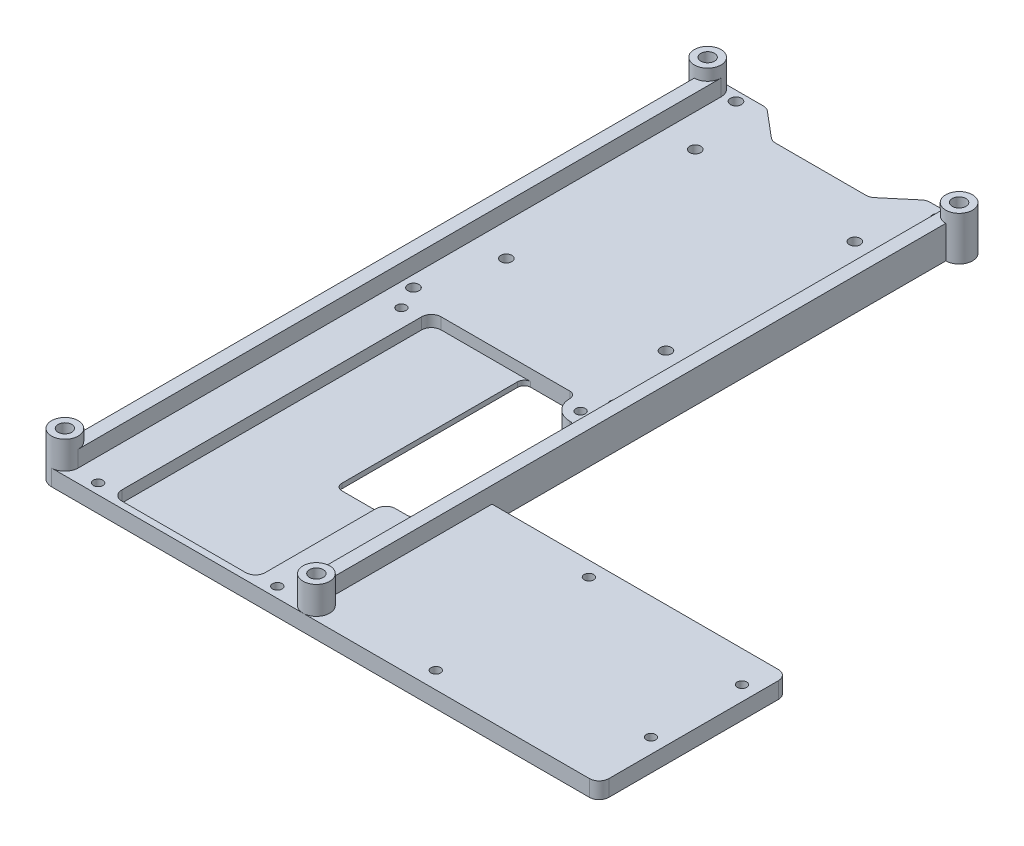
from build123d import *

# Parameters (mm, degrees)
ESQUISSE1_R                                = 1.7
ESQUISSE1_R_2                              = 1.45
BOSS_EXTRU_1_DEPTH                         = 5
ESQUISSE2_W                                = 44
ESQUISSE2_H                                = 98
ENL_V_MAT_PCB_ECRAN_INO_DEPTH              = 3.5
ENL_V_MAT_PCB_EXCROISSANCE_ECRAN_INO_DEPTH = 201.128708585
CONG_EXCROISSANCE_PCB_ECRAN_INO_R          = 2
ESQUISSE10_R                               = 2.1
BOSS_EXTRU_3_DEPTH                         = 13.5
ENL_V_START                                = -8.5
ESQUISSE13_R                               = 5.798275606
ESQUISSE13_R_2                             = 4.1
ENL_V_MAT_EXTRU_4_DEPTH                    = 8.5
ESQUISSE14_R                               = 2.1
ENL_V_MAT_EXTRU_5_DEPTH                    = 201.24672282
CONG_1_R                                   = 6
BOSS_EXTRU_10_DEPTH                        = 10
BOSS_EXTRU_10_2_DEPTH                      = 10
CONG_GLOBAL_R                              = 3


with BuildPart() as part:
    # Esquisse1 → Boss.-Extru.1 (new body)
    with BuildSketch(Plane(origin=(0, 0, 0), x_dir=(1, 0, 0), z_dir=(0, 1, 0))):
        Polygon((-15, 45), (15, 45), (24.5, 53), (34.5, 53), (34.5, -53), (34.5, -94.5), (129.5, -94.5), (129.5, -152.5), (34.5, -152.5), (-34.5, -152.5), (-34.5, -53), (-34.5, 53), (-24.5, 53), align=None)
        with Locations(Location((31, 50, 0), (0, 0, 270))):
            Circle(ESQUISSE1_R, mode=Mode.SUBTRACT)
        with Locations(Location((31, -49, 0), (0, 0, 90))):
            Circle(ESQUISSE1_R, mode=Mode.SUBTRACT)
        with Locations(Location((27.5, -56.2, 0), (0, 0, 270))):
            Circle(ESQUISSE1_R_2, mode=Mode.SUBTRACT)
        with Locations(Location((27.5, -149.3, 0), (0, 0, 90))):
            Circle(ESQUISSE1_R_2, mode=Mode.SUBTRACT)
        with Locations(Location((-27.5, -149.3, 0), (0, 0, 270))):
            Circle(ESQUISSE1_R_2, mode=Mode.SUBTRACT)
        with Locations(Location((-27.5, -56.2, 0), (0, 0, 90))):
            Circle(ESQUISSE1_R_2, mode=Mode.SUBTRACT)
        with Locations(Location((-31, -49, 0), (0, 0, 270))):
            Circle(ESQUISSE1_R, mode=Mode.SUBTRACT)
        with Locations(Location((-31, 50, 0), (0, 0, 90))):
            Circle(ESQUISSE1_R, mode=Mode.SUBTRACT)
        with Locations(Location((-24.5, 31, 0), (0, 0, 270))):
            Circle(ESQUISSE1_R, mode=Mode.SUBTRACT)
        with Locations(Location((24.5, 31, 0), (0, 0, 90))):
            Circle(ESQUISSE1_R, mode=Mode.SUBTRACT)
        with Locations(Location((72.889998169, -99.04, 0), (0, 0, 270))):
            Circle(ESQUISSE1_R_2, mode=Mode.SUBTRACT)
        with Locations(Location((24.5, -27, 0), (0, 0, 270))):
            Circle(ESQUISSE1_R, mode=Mode.SUBTRACT)
        with Locations(Location((-24.5, -27, 0), (0, 0, 90))):
            Circle(ESQUISSE1_R, mode=Mode.SUBTRACT)
        with Locations(Location((124.959998169, -104.12, 0), (0, 0, 270))):
            Circle(ESQUISSE1_R_2, mode=Mode.SUBTRACT)
        with Locations(Location((124.959998169, -132.06, 0), (0, 0, 270))):
            Circle(ESQUISSE1_R_2, mode=Mode.SUBTRACT)
        with Locations(Location((74.159998169, -147.3, 0), (0, 0, 270))):
            Circle(ESQUISSE1_R_2, mode=Mode.SUBTRACT)
    extrude(amount=BOSS_EXTRU_1_DEPTH)

    # Esquisse2 → Enlèv. mat.-pcb ecran ino (cut)
    with BuildSketch(Plane(origin=(0, 5, 0), x_dir=(1, 0, 0), z_dir=(0, 1, 0))):
        with Locations((0, -101.5)):
            Rectangle(ESQUISSE2_W, ESQUISSE2_H)
    extrude(amount=-ENL_V_MAT_PCB_ECRAN_INO_DEPTH, mode=Mode.SUBTRACT)

    # Esquisse3 → Enlèv. mat.- pcb excroissance ecran ino (cut, through all)
    with BuildSketch(Plane(origin=(0, 5, 0), x_dir=(1, 0, 0), z_dir=(0, 1, 0))):
        Polygon((30.5, -110.5), (30.5, -60.5), (22.5, -60.5), (22.5, -52.5), (6.5, -52.5), (6.5, -110.5), align=None)
    extrude(amount=-ENL_V_MAT_PCB_EXCROISSANCE_ECRAN_INO_DEPTH, mode=Mode.SUBTRACT)

    # Congé excroissance pcb ecran ino
    cong_excroissance_pcb_ecran_ino_edges = [part.edges().sort_by_distance(p)[0] for p in [
        (6.5, 0.75, 110.5),
        (6.5, 0.75, 52.5),
        (30.5, 2.5, 110.5),
        (22.5, 2.5, 52.5),
        (30.5, 2.5, 60.5),
    ]]
    fillet(cong_excroissance_pcb_ecran_ino_edges, radius=CONG_EXCROISSANCE_PCB_ECRAN_INO_R)

    # Esquisse10 → Boss.-Extru.3 (add)
    # profile 1 of 4: a face of its own
    with BuildSketch(Plane.XZ):
        with BuildLine():
            Line((-34.5, -53), (-38.6, -53))
            ThreePointArc((-38.6, -53), (-42.7, -48.9), (-38.6, -44.8))
            Line((-38.6, -44.8), (-34.5, -44.8))
            Line((-34.5, -44.8), (-34.5, -53))
        make_face()
        with Locations(Location((-38.6, -48.9, 0), (0, 0, 270))):
            Circle(ESQUISSE10_R, mode=Mode.SUBTRACT)
    # profile 2 of 4: a face of its own
    with BuildSketch(Plane.XZ):
        with BuildLine():
            Line((34.5, -44.8), (38.6, -44.8))
            ThreePointArc((38.6, -44.8), (42.7, -48.9), (38.6, -53))
            Line((38.6, -53), (34.5, -53))
            Line((34.5, -53), (34.5, -44.8))
        make_face()
        with Locations(Location((38.6, -48.9, 0), (0, 0, 90))):
            Circle(ESQUISSE10_R, mode=Mode.SUBTRACT)
    # profile 3 of 4: a face of its own
    with BuildSketch(Plane.XZ):
        with BuildLine():
            Line((34.5, 152.5), (38.6, 152.5))
            ThreePointArc((38.6, 152.5), (42.7, 148.4), (38.6, 144.3))
            Line((38.6, 144.3), (34.5, 144.3))
            Line((34.5, 144.3), (34.5, 152.5))
        make_face()
        with Locations(Location((38.6, 148.4, 0), (0, 0, 270))):
            Circle(ESQUISSE10_R, mode=Mode.SUBTRACT)
    # profile 4 of 4: a face of its own
    with BuildSketch(Plane.XZ):
        with BuildLine():
            Line((-34.5, 144.3), (-38.6, 144.3))
            ThreePointArc((-38.6, 144.3), (-42.7, 148.4), (-38.6, 152.5))
            Line((-38.6, 152.5), (-34.5, 152.5))
            Line((-34.5, 152.5), (-34.5, 144.3))
        make_face()
        with Locations(Location((-38.6, 148.4, 0), (0, 0, 90))):
            Circle(ESQUISSE10_R, mode=Mode.SUBTRACT)
    extrude(amount=-BOSS_EXTRU_3_DEPTH)

    # Esquisse13 → Enlèv. mat.-Extru.4 (cut)
    # profile 1 of 4: a face of its own
    with BuildSketch(Plane(origin=(0, 13.5, 0), x_dir=(1, 0, 0), z_dir=(0, 1, 0)).offset(ENL_V_START)):
        with Locations((-38.6, -148.4)):
            Circle(ESQUISSE13_R)
        with Locations(Location((-38.6, -148.4, 0), (0, 0, 90))):
            Circle(ESQUISSE13_R_2, mode=Mode.SUBTRACT)
    # profile 2 of 4: a face of its own
    with BuildSketch(Plane(origin=(0, 13.5, 0), x_dir=(1, 0, 0), z_dir=(0, 1, 0)).offset(ENL_V_START)):
        with Locations((38.6, -148.4)):
            Circle(ESQUISSE13_R)
        with Locations(Location((38.6, -148.4, 0), (0, 0, 270))):
            Circle(ESQUISSE13_R_2, mode=Mode.SUBTRACT)
    # profile 3 of 4: a face of its own
    with BuildSketch(Plane(origin=(0, 13.5, 0), x_dir=(1, 0, 0), z_dir=(0, 1, 0)).offset(ENL_V_START)):
        with Locations((38.6, 48.9)):
            Circle(ESQUISSE13_R)
        with Locations(Location((38.6, 48.9, 0), (0, 0, 90))):
            Circle(ESQUISSE13_R_2, mode=Mode.SUBTRACT)
    # profile 4 of 4: a face of its own
    with BuildSketch(Plane(origin=(0, 13.5, 0), x_dir=(1, 0, 0), z_dir=(0, 1, 0)).offset(ENL_V_START)):
        with Locations((-38.6, 48.9)):
            Circle(ESQUISSE13_R)
        with Locations(Location((-38.6, 48.9, 0), (0, 0, 270))):
            Circle(ESQUISSE13_R_2, mode=Mode.SUBTRACT)
    extrude(amount=ENL_V_MAT_EXTRU_4_DEPTH, mode=Mode.SUBTRACT)

    # Esquisse14 → Enlèv. mat.-Extru.5 (cut, through all)
    with BuildSketch(Plane(origin=(0, 5, 0), x_dir=(1, 0, 0), z_dir=(0, 1, 0))):
        with Locations(Location((38.6, -148.4, 0), (0, 0, 90))):
            Circle(ESQUISSE14_R)
    extrude(amount=-ENL_V_MAT_EXTRU_5_DEPTH, mode=Mode.SUBTRACT)

    # Congé1
    cong_1_edges = [part.edges().sort_by_distance(p)[0] for p in [
        (22.5, 2.5, 60.5),
    ]]
    fillet(cong_1_edges, radius=CONG_1_R - 0.0001)  # a hair under: the kernel refuses the full size

    # Congé global
    cong_global_edges = [part.edges().sort_by_distance(p)[0] for p in [
        (-22, 3.25, 150.5),
        (-22, 3.25, 52.5),
        (22, 3.25, 150.5),
        (22, 3.25, 110.5),
        (24.5, 2.5, -53),
        (34.5, 2.5, 94.5),
        (129.5, 2.5, 94.5),
        (129.5, 2.5, 152.5),
        (-24.5, 2.5, -53),
        (-15, 2.5, -45),
        (15, 2.5, -45),
    ]]
    fillet(cong_global_edges, radius=CONG_GLOBAL_R)


with BuildPart() as body_2:
    # Esquisse19 → Boss.-Extru.10 (new body)
    with BuildSketch(Plane(origin=(0, 0, 0), x_dir=(1, 0, 0), z_dir=(0, 1, 0))):
        with BuildLine():
            Line((-34.5, 48.9), (-34.5, -148.4))
            ThreePointArc((-34.5, -148.4), (-35.700862197, -145.500862197), (-38.6, -144.3))
            Line((-38.6, -144.3), (-38.6, 44.8))
            ThreePointArc((-38.6, 44.8), (-35.700862197, 46.000862197), (-34.5, 48.9))
        make_face()
    extrude(amount=BOSS_EXTRU_10_DEPTH)


with BuildPart() as body_3:
    # Esquisse19 → Boss.-Extru.10 2 (new body)
    with BuildSketch(Plane(origin=(0, 0, 0), x_dir=(1, 0, 0), z_dir=(0, 1, 0))):
        with BuildLine():
            Line((38.6, 44.8), (38.6, -144.3))
            ThreePointArc((38.6, -144.3), (35.700862197, -145.500862197), (34.5, -148.4))
            Line((34.5, -148.4), (34.5, 48.9))
            ThreePointArc((34.5, 48.9), (35.700862197, 46.000862197), (38.6, 44.8))
        make_face()
    extrude(amount=BOSS_EXTRU_10_2_DEPTH)


solid = Compound([part.part, body_2.part, body_3.part])
